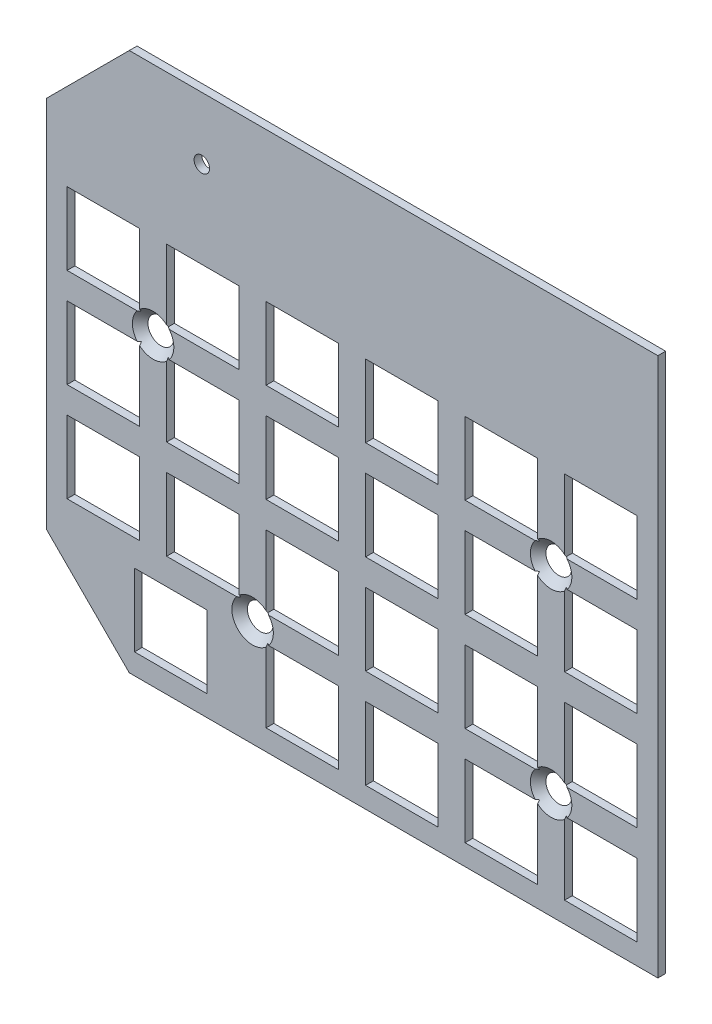
from build123d import *

# Parameters (mm, degrees)
BOSS_EXTRU_1_DEPTH                          = 1.5
ESQUISSE2_R                                 = 1.5
ESQUISSE2_W                                 = 14
ESQUISSE2_H                                 = 14
ENL_V_MAT_EXTRU_1_DEPTH                     = 1.5
FRAISAGE_POUR_VIS_T_TE_FRAIS_E_M42_AT_COUNT = 2
FRAISAGE_POUR_VIS_T_TE_FRAIS_E_M42_AT_PITCH = 76.8
FRAISAGE_POUR_VIS_T_TE_FRAIS_E_M42_2_COUNT  = 2
FRAISAGE_POUR_VIS_T_TE_FRAIS_E_M42_2_PITCH  = 85.761100938
FRAISAGE_POUR_VIS_T_TE_FRAIS_E_M42_3_COUNT  = 2
FRAISAGE_POUR_VIS_T_TE_FRAIS_E_M42_3_PITCH  = 42.724307298


with BuildPart() as part:
    # Esquisse1 → Boss.-Extru.1 (new body)
    with BuildSketch(Plane.XY):
        Polygon((0, -85), (16, -101), (118, -101), (118, 3), (16, 3), (0, -13), align=None)
    extrude(amount=BOSS_EXTRU_1_DEPTH)

    # Esquisse2 → Enlèv. mat.-Extru.1 (cut)
    with BuildSketch(Plane.XY.offset(1.5)):
        with Locations((30, -9)):
            Circle(ESQUISSE2_R)
        with Locations((11, -32.749371385)):
            Rectangle(ESQUISSE2_W, ESQUISSE2_H)
        with Locations((30.2, -32.749371385)):
            Rectangle(ESQUISSE2_W, ESQUISSE2_H)
        with Locations((49.4, -32.749371385)):
            Rectangle(ESQUISSE2_W, ESQUISSE2_H)
        with Locations((68.6, -32.749371385)):
            Rectangle(ESQUISSE2_W, ESQUISSE2_H)
        with Locations((87.8, -32.749371385)):
            Rectangle(ESQUISSE2_W, ESQUISSE2_H)
        with Locations((107, -32.749371385)):
            Rectangle(ESQUISSE2_W, ESQUISSE2_H)
        with Locations((30.2, -51.832914257)):
            Rectangle(ESQUISSE2_W, ESQUISSE2_H)
        with Locations((49.4, -51.832914257)):
            Rectangle(ESQUISSE2_W, ESQUISSE2_H)
        with Locations((68.6, -51.832914257)):
            Rectangle(ESQUISSE2_W, ESQUISSE2_H)
        with Locations((87.8, -51.832914257)):
            Rectangle(ESQUISSE2_W, ESQUISSE2_H)
        with Locations((107, -51.832914257)):
            Rectangle(ESQUISSE2_W, ESQUISSE2_H)
        with Locations((30.2, -70.916457128)):
            Rectangle(ESQUISSE2_W, ESQUISSE2_H)
        with Locations((49.4, -70.916457128)):
            Rectangle(ESQUISSE2_W, ESQUISSE2_H)
        with Locations((68.6, -70.916457128)):
            Rectangle(ESQUISSE2_W, ESQUISSE2_H)
        with Locations((87.8, -70.916457128)):
            Rectangle(ESQUISSE2_W, ESQUISSE2_H)
        with Locations((107, -70.916457128)):
            Rectangle(ESQUISSE2_W, ESQUISSE2_H)
        with Locations((11, -51.832914257)):
            Rectangle(ESQUISSE2_W, ESQUISSE2_H)
        with Locations((11, -70.916457128)):
            Rectangle(ESQUISSE2_W, ESQUISSE2_H)
        with Locations((49.4, -90)):
            Rectangle(ESQUISSE2_W, ESQUISSE2_H)
        with Locations((68.6, -90)):
            Rectangle(ESQUISSE2_W, ESQUISSE2_H)
        with Locations((87.8, -90)):
            Rectangle(ESQUISSE2_W, ESQUISSE2_H)
        with Locations((107, -90)):
            Rectangle(ESQUISSE2_W, ESQUISSE2_H)
        with Locations((24, -90)):
            Rectangle(ESQUISSE2_W, ESQUISSE2_H)
    extrude(amount=-ENL_V_MAT_EXTRU_1_DEPTH, mode=Mode.SUBTRACT)

    # Esquisse18 → Fraisage pour vis à tête fraisée M42 (revolve, cut)
    with BuildSketch(Plane(origin=(20.6, -42.291142821, 1.5), x_dir=(0, -1, 0), z_dir=(1, 0, 0))):
        Polygon((0, 0), (0, 1.5), (2.25, 1.5), (2.25, 1.75), (4, 0), align=None)
    fraisage_pour_vis_t_te_frais_e_m42 = revolve(axis=Axis((20.6, -42.291142821, 7.85), (0, 0, -1)), mode=Mode.SUBTRACT)

    # Fraisage pour vis à tête fraisée M42 at: Fraisage pour vis à tête fraisée M42 ×2
    with Locations(*[(i * FRAISAGE_POUR_VIS_T_TE_FRAIS_E_M42_AT_PITCH, 0, 0) for i in range(1, FRAISAGE_POUR_VIS_T_TE_FRAIS_E_M42_AT_COUNT)]):
        add(fraisage_pour_vis_t_te_frais_e_m42, mode=Mode.SUBTRACT)

    # Fraisage pour vis _ t_te frais_e M42 2: Fraisage pour vis à tête fraisée M42 ×2
    with Locations(*[Vector(0.8955108919993005, -0.4450395963401655, 0) * (i * FRAISAGE_POUR_VIS_T_TE_FRAIS_E_M42_2_PITCH) for i in range(1, FRAISAGE_POUR_VIS_T_TE_FRAIS_E_M42_2_COUNT)]):
        add(fraisage_pour_vis_t_te_frais_e_m42, mode=Mode.SUBTRACT)

    # Fraisage pour vis _ t_te frais_e M42 3: Fraisage pour vis à tête fraisée M42 ×2
    with Locations(*[Vector(0.44939289163639756, -0.8933342201811576, 0) * (i * FRAISAGE_POUR_VIS_T_TE_FRAIS_E_M42_3_PITCH) for i in range(1, FRAISAGE_POUR_VIS_T_TE_FRAIS_E_M42_3_COUNT)]):
        add(fraisage_pour_vis_t_te_frais_e_m42, mode=Mode.SUBTRACT)


solid = part.part
